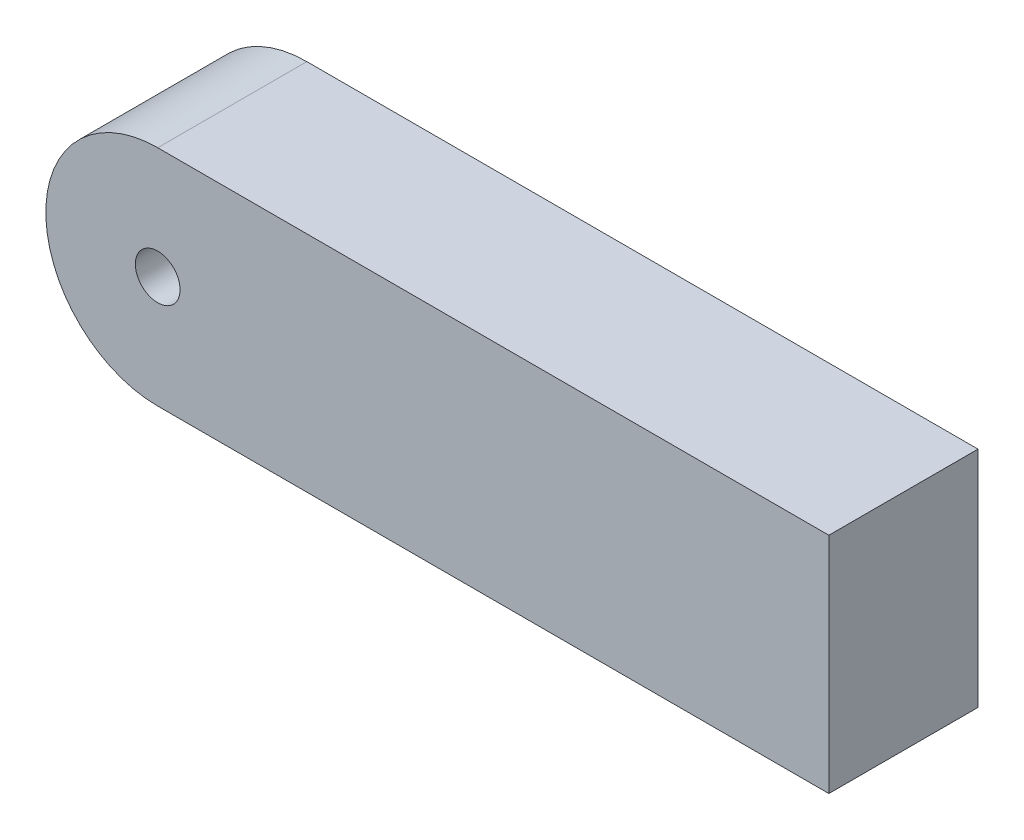
from build123d import *

# Parameters (mm, degrees)
SKETCH_1_R      = 3
EXTRUDE_1_DEPTH = 20


with BuildPart() as part:
    # 草图1 → 凸台-拉伸1 (new body)
    with BuildSketch(Plane.XY):
        with BuildLine():
            Line((-45, 15), (45, 15))
            Line((45, 15), (45, -15))
            Line((45, -15), (-45, -15))
            ThreePointArc((-45, -15), (-60, 0), (-45, 15))
        make_face()
        with Locations((-45, 0)):
            Circle(SKETCH_1_R, mode=Mode.SUBTRACT)
    extrude(amount=EXTRUDE_1_DEPTH)


solid = part.part
